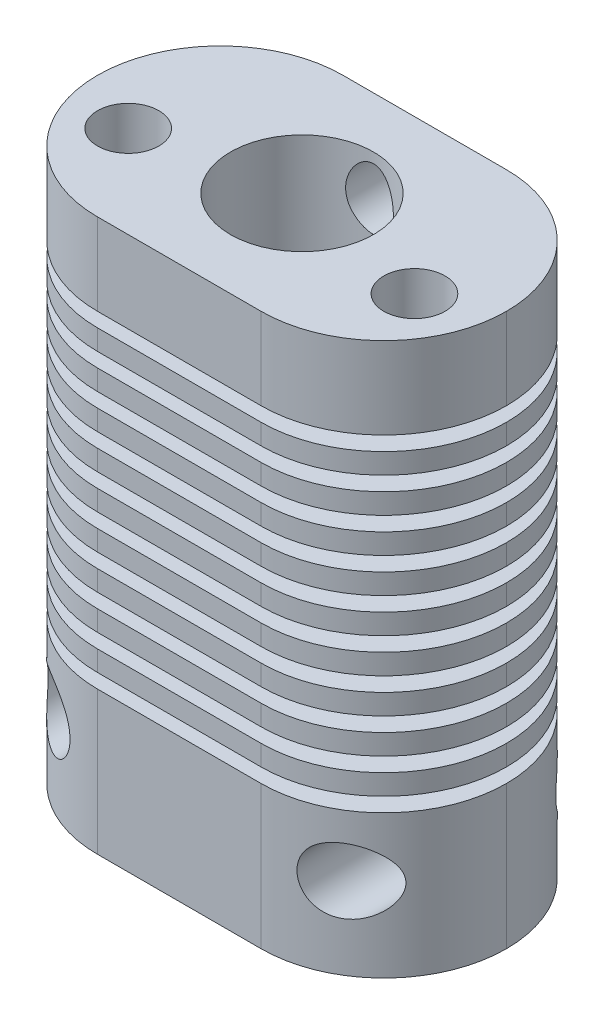
from build123d import *

# Parameters (mm, degrees)
SZKIC1_W                    = 20
SZKIC1_H                    = 27
DODANIE_WYCI_GNI_CIE1_DEPTH = 12
ZAOKR_GLENIE2_R             = 6
SKETCH3_W                   = 6.414141748
SKETCH3_H                   = 0.7
F_3_0MM_DOWEL_HOLE2_D       = 3
F_3_0MM_DOWEL_HOLE2_DEPTH   = 2.5
F_3_0MM_DOWEL_HOLE2_TIP     = 0.901290929
F_3_0MM_DOWEL_HOLE3_D       = 3.2
F_6_0MM_DOWEL_HOLE1_D       = 7
F_6_0MM_DOWEL_HOLE1_DEPTH   = 16.6
F_3_0MM_DOWEL_HOLE4_D       = 3
F_3_0MM_DOWEL_HOLE4_DEPTH   = 3
F_3_0MM_DOWEL_HOLE4_TIP     = 0.901290929
F_5_0MM_DOWEL_HOLE1_D       = 5
F_5_0MM_DOWEL_HOLE1_DEPTH   = 2.4
F_10_0MM_DOWEL_HOLE3_D      = 10
F_10_0MM_DOWEL_HOLE3_DEPTH  = 6
F_10_0MM_DOWEL_HOLE3_TIP    = 3.004303095


with BuildPart() as part:
    # Szkic1 → Dodanie-wyciągnięcie1 (new body)
    with BuildSketch(Plane.XY):
        with Locations((10, 13.5)):
            Rectangle(SZKIC1_W, SZKIC1_H)
    extrude(amount=DODANIE_WYCI_GNI_CIE1_DEPTH)

    # Zaokrąglenie2
    zaokr_glenie2_edges = [part.edges().sort_by_distance(p)[0] for p in [
        (20, 13.5, 0),
        (20, 13.5, 12),
        (0, 13.5, 0),
        (0, 13.5, 12),
    ]]
    fillet(zaokr_glenie2_edges, radius=ZAOKR_GLENIE2_R - 0.0001)  # a hair under: the kernel refuses the full size

    # Sketch3 → Cut-Revolve1 (revolve, cut)
    with BuildSketch(Plane.ZY.offset(-10), mode=Mode.PRIVATE) as cut_revolve1_sk:
        with Locations((-1.507070874, 22.65)):
            Rectangle(SKETCH3_W, SKETCH3_H)
        with Locations((-1.507070874, 20.95)):
            Rectangle(SKETCH3_W, SKETCH3_H)
        with Locations((-1.507070874, 19.25)):
            Rectangle(SKETCH3_W, SKETCH3_H)
        with Locations((-1.507070874, 17.55)):
            Rectangle(SKETCH3_W, SKETCH3_H)
        with Locations((-1.507070874, 15.85)):
            Rectangle(SKETCH3_W, SKETCH3_H)
        with Locations((-1.507070874, 14.15)):
            Rectangle(SKETCH3_W, SKETCH3_H)
        with Locations((-1.507070874, 12.45)):
            Rectangle(SKETCH3_W, SKETCH3_H)
        with Locations((-1.507070874, 10.75)):
            Rectangle(SKETCH3_W, SKETCH3_H)
        with Locations((-1.507070874, 9.05)):
            Rectangle(SKETCH3_W, SKETCH3_H)
        with Locations((-1.507070874, 7.35)):
            Rectangle(SKETCH3_W, SKETCH3_H)
    revolve(cut_revolve1_sk.sketch.rotate(Axis((10, 26.25563002, 6), (0, -1, 0)), 180), axis=Axis((10, 26.25563002, 6), (0, -1, 0)), mode=Mode.SUBTRACT)

    # Ø3.0mm Dowel Hole2
    with Locations(Plane(origin=(0, 0, 0), x_dir=(-1, 0, 0), z_dir=(0, 0, -1))):
        with Locations((-10, 25)):
            Hole(F_3_0MM_DOWEL_HOLE2_D / 2, depth=F_3_0MM_DOWEL_HOLE2_DEPTH)
            with Locations((0, 0, -(F_3_0MM_DOWEL_HOLE2_DEPTH + F_3_0MM_DOWEL_HOLE2_TIP / 2))):  # 118° drill point
                Cone(0, F_3_0MM_DOWEL_HOLE2_D / 2, F_3_0MM_DOWEL_HOLE2_TIP, mode=Mode.SUBTRACT)

    # Ø3.0mm Dowel Hole3 (through all)
    with Locations(Plane(origin=(17.15, 4, 0), x_dir=(-1, 0, 0), z_dir=(0, 0, -1))):
        with Locations((0, 0), (14.3, 0)):
            Hole(F_3_0MM_DOWEL_HOLE3_D / 2)

    # Ø6.0mm Dowel Hole1
    with Locations(Plane(origin=(0, 27, 0), x_dir=(1, 0, 0), z_dir=(0, 1, 0))):
        with Locations((10, -6)):
            Hole(F_6_0MM_DOWEL_HOLE1_D / 2, depth=F_6_0MM_DOWEL_HOLE1_DEPTH)

    # Ø3.0mm Dowel Hole4
    with Locations(Plane(origin=(0, 27, 0), x_dir=(1, 0, 0), z_dir=(0, 1, 0))):
        with Locations((17, -7.5), (3, -7.5)):
            Hole(F_3_0MM_DOWEL_HOLE4_D / 2, depth=F_3_0MM_DOWEL_HOLE4_DEPTH)
            with Locations((0, 0, -(F_3_0MM_DOWEL_HOLE4_DEPTH + F_3_0MM_DOWEL_HOLE4_TIP / 2))):  # 118° drill point
                Cone(0, F_3_0MM_DOWEL_HOLE4_D / 2, F_3_0MM_DOWEL_HOLE4_TIP, mode=Mode.SUBTRACT)

    # Ø5.0mm Dowel Hole1
    with Locations(Plane(origin=(0, 10.4, 0), x_dir=(1, 0, 0), z_dir=(0, 1, 0))):
        with Locations((10, -6)):
            Hole(F_5_0MM_DOWEL_HOLE1_D / 2, depth=F_5_0MM_DOWEL_HOLE1_DEPTH)

    # Ø10.0mm Dowel Hole3
    with Locations(Plane(origin=(0, 0, 0), x_dir=(-1, 0, 0), z_dir=(0, -1, 0))):
        with Locations((-10, -6)):
            Hole(F_10_0MM_DOWEL_HOLE3_D / 2, depth=F_10_0MM_DOWEL_HOLE3_DEPTH)
            with Locations((0, 0, -(F_10_0MM_DOWEL_HOLE3_DEPTH + F_10_0MM_DOWEL_HOLE3_TIP / 2))):  # 118° drill point
                Cone(0, F_10_0MM_DOWEL_HOLE3_D / 2, F_10_0MM_DOWEL_HOLE3_TIP, mode=Mode.SUBTRACT)


solid = part.part
